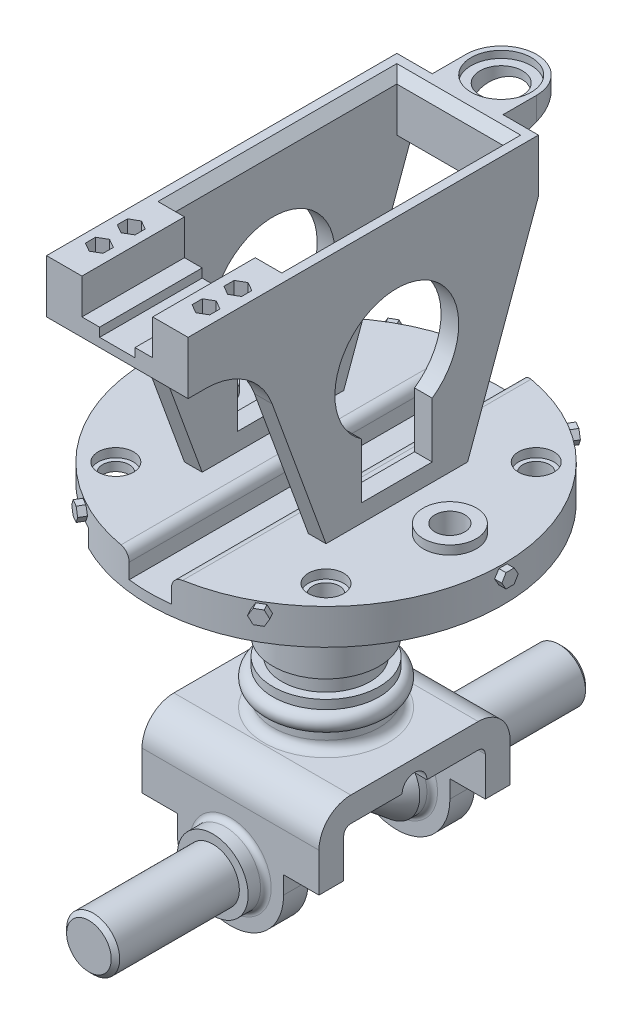
from build123d import *
from build123d.topology import SkipClean

# Parameters (mm, degrees)
SKETCH5_W               = 63.5
SKETCH5_H               = 12.7
SKETCH6_W               = 34.925
SKETCH6_H               = 6.35
CUT_EXTRUDE2_DEPTH      = 63.5
SKETCH7_W               = 15.24
SKETCH7_H               = 8.89
CUT_EXTRUDE3_DEPTH      = 63.5
FILLET1_R               = 3.429
F_3_8_16_TAPPED_HOLE1_D = 9.525
SKETCH14_R              = 6.35
CUT_EXTRUDE4_DEPTH      = 3.175
BOSS_EXTRUDE2_START     = 3.175
SKETCH15_R              = 9.525
SKETCH15_R_2            = 5.35813
BOSS_EXTRUDE2_DEPTH     = 3.175
CHAMFER2_SIZE           = 2.54
BOSS_EXTRUDE3_START     = 63.5
BOSS_EXTRUDE3_DEPTH     = 2.54
CIRPATTERN6_COUNT       = 6
BOSS_EXTRUDE5_DEPTH     = 25.4
SKETCH23_W              = 38.1
SKETCH23_H              = 69.85
CUT_EXTRUDE5_DEPTH      = 81.28
CUT_EXTRUDE6_DEPTH      = 156.868034501
CUT_EXTRUDE7_REACH      = 144.46
SKETCH26_W              = 38.1
SKETCH26_H              = 82.55
CHAMFER1_SIZE           = 3.175
CUT_EXTRUDE8_REACH      = 185.957
CUT_EXTRUDE9_REACH      = 144.46
BOSS_EXTRUDE6_DEPTH     = 12.7
FILLET2_R               = 12.7
CUT_EXTRUDE10_REACH     = 144.807
SKETCH29_R              = 7.62
SKETCH30_R              = 10.795
CUT_EXTRUDE11_DEPTH     = 2.54
BOSS_EXTRUDE7_DEPTH     = 31.75
BOSS_EXTRUDE8_DEPTH     = 8.89
FILLET3_R               = 1.905
FILLET4_R               = 3.175


# Read off the part's stored shape, not the designer's step: 3/4-10 Machine Threads Stud1, 3/4-10 Machine Threads Stud2
with BuildPart() as part:
    # Sketch5 → Revolve1 (revolve)
    with BuildSketch(Plane.XY):
        with Locations((31.75, 6.35)):
            Rectangle(SKETCH5_W, SKETCH5_H)
    revolve(axis=Axis((0, 0, 0), (0, 1, 0)))

    # Sketch6 → Cut-Extrude2 (cut, symmetric)
    with BuildSketch(Plane.XY):
        with Locations((-46.0375, 3.175)):
            Rectangle(SKETCH6_W, SKETCH6_H)
    extrude(amount=CUT_EXTRUDE2_DEPTH, both=True, mode=Mode.SUBTRACT)

    # Sketch7 → Cut-Extrude3 (cut, symmetric)
    with BuildSketch(Plane.XY):
        with Locations((0, 8.255)):
            Rectangle(SKETCH7_W, SKETCH7_H)
    extrude(amount=CUT_EXTRUDE3_DEPTH, both=True, mode=Mode.SUBTRACT)

    # Fillet1
    fillet1_edges = [part.edges().sort_by_distance(p)[0] for p in [
        (-7.62, 12.7, 0),
        (7.62, 12.7, 0),
    ]]
    fillet(fillet1_edges, radius=FILLET1_R)

    # Sketch10 → 1/2-13 Tapped Hole1 (revolve, cut)
    with BuildSketch(Plane(origin=(-44.45, 12.7, 0), x_dir=(0, 0, 1), z_dir=(1, 0, 0))):
        Polygon((0, 0), (0, 34.461489309), (5.35813, 31.242), (5.35813, 0), align=None)
    f_1_2_13_tapped_hole1 = revolve(axis=Axis((-44.45, 19.05, 0), (0, -1, 0)), mode=Mode.SUBTRACT)

    # 3/8-16 Tapped Hole1 (through all)
    with Locations(Plane(origin=(-37.717075708, 12.7, -37.717075708), x_dir=(1, 0, 0), z_dir=(0, 1, 0))):
        with Locations((0, 0), (0, -75.434151416)):
            f_3_8_16_tapped_hole1 = Hole(F_3_8_16_TAPPED_HOLE1_D / 2)

    # Sketch14 → Cut-Extrude4 (cut)
    with BuildSketch(Plane(origin=(0, 12.7, 0), x_dir=(1, 0, 0), z_dir=(0, 1, 0))):
        with Locations(Location((-37.717075708, 37.717075708, 0), (0, 0, 180))):
            Circle(SKETCH14_R)
        with Locations(Location((-37.717075708, -37.717075708, 0), (0, 0, 180))):
            Circle(SKETCH14_R)
    cut_extrude4 = extrude(amount=-CUT_EXTRUDE4_DEPTH, mode=Mode.SUBTRACT)

    # Sketch15 → Boss-Extrude2 (add)
    with SkipClean():  # the faces are left unmerged after this step: merging them gives an invalid solid
        with BuildSketch(Plane(origin=(0, 12.7, 0), x_dir=(1, 0, 0), z_dir=(0, 1, 0)).offset(BOSS_EXTRUDE2_START)):
            with Locations(Location((-44.45, 0, 0), (0, 0, 180))):
                Circle(SKETCH15_R)
            with Locations(Location((-44.45, 0, 0), (0, 0, 180))):
                Circle(SKETCH15_R_2, mode=Mode.SUBTRACT)
        boss_extrude2 = extrude(amount=-BOSS_EXTRUDE2_DEPTH)

    # Mirror1: 1/2-13 Tapped Hole1, 3/8-16 Tapped Hole1, Cut-Extrude4, Boss-Extrude2 across plane
    with SkipClean():  # the faces are left unmerged after this step: merging them gives an invalid solid
        add(f_1_2_13_tapped_hole1.mirror(Plane(origin=(0, 0, 0), x_dir=(0, 0, 1), z_dir=(1, 0, 0))), mode=Mode.SUBTRACT)
        add(f_3_8_16_tapped_hole1.mirror(Plane(origin=(0, 0, 0), x_dir=(0, 0, 1), z_dir=(1, 0, 0))), mode=Mode.SUBTRACT)
        add(cut_extrude4.mirror(Plane(origin=(0, 0, 0), x_dir=(0, 0, 1), z_dir=(1, 0, 0))), mode=Mode.SUBTRACT)
        add(boss_extrude2.mirror(Plane(origin=(0, 0, 0), x_dir=(0, 0, 1), z_dir=(1, 0, 0))))

    # Chamfer2
    chamfer2_edges = [part.edges().sort_by_distance(p)[0] for p in [
        (44.45, 0, -5.35813),
        (-44.45, 6.35, -5.35813),
    ]]
    chamfer(chamfer2_edges, length=CHAMFER2_SIZE)


with BuildPart() as body_2:
    # Sketch17 → Boss-Extrude3 (new, symmetric)
    with BuildSketch(Plane(origin=(0, 0, 0), x_dir=(0, 0, -1), z_dir=(1, 0, 0)).offset(BOSS_EXTRUDE3_START)):
        Polygon((2.932939367, 9.525), (1.466469684, 12.065), (-1.466469684, 12.065), (-2.932939367, 9.525), (-1.466469684, 6.985), (1.466469684, 6.985), align=None)
    boss_extrude3 = extrude(amount=BOSS_EXTRUDE3_DEPTH, both=True)


with BuildPart() as part_1:
    add(part.part)

    # Combine9: union body 2
    add(body_2.part)

    # CirPattern6: Boss-Extrude3 ×6 about axis
    cirpattern6_axis = Axis((0, 0, 0), (0, 1, 0))
    for i in range(1, CIRPATTERN6_COUNT):
        add(boss_extrude3.rotate(cirpattern6_axis, i * 360 / CIRPATTERN6_COUNT))

    # Sketch22 → Boss-Extrude5 (add, symmetric)
    with BuildSketch(Plane(origin=(0, 0, 0), x_dir=(0, 0, -1), z_dir=(1, 0, 0))):
        with BuildLine():
            Line((-25.4, 12.7), (25.4, 12.7))
            Line((25.4, 12.7), (50.823320863, 82.55))
            Line((50.823320863, 82.55), (50.823320863, 101.6))
            Line((50.823320863, 101.6), (-74.906679137, 101.6))
            Line((-74.906679137, 101.6), (-74.906679137, 82.55))
            Line((-74.906679137, 82.55), (-68.608592334, 82.55))
            ThreePointArc((-68.608592334, 82.55), (-54.039750851, 77.956461925), (-44.740399766, 65.83731164))
            Line((-44.740399766, 65.83731164), (-25.4, 12.7))
        make_face()
    extrude(amount=BOSS_EXTRUDE5_DEPTH, both=True)

    # Sketch23 → Cut-Extrude5 (cut, symmetric)
    with BuildSketch(Plane.XY):
        with Locations((0, 47.625)):
            Rectangle(SKETCH23_W, SKETCH23_H)
    extrude(amount=CUT_EXTRUDE5_DEPTH, both=True, mode=Mode.SUBTRACT)

    # Sketch24 → Cut-Extrude6 (cut, through all)
    with BuildSketch(Plane(origin=(25.4, 0, 0), x_dir=(0, 0, -1), z_dir=(1, 0, 0))):
        with BuildLine():
            Line((-12.7, 38.911013597), (-12.7, 19.05))
            Line((-12.7, 19.05), (12.7, 19.05))
            Line((12.7, 19.05), (12.7, 38.911013597))
            ThreePointArc((12.7, 38.911013597), (0, 79.375), (-12.7, 38.911013597))
        make_face()
    extrude(amount=-CUT_EXTRUDE6_DEPTH, mode=Mode.SUBTRACT)

    # Sketch26 → Cut-Extrude7 (cut, up to next)
    with BuildSketch(Plane(origin=(0, 101.6, 0), x_dir=(1, 0, 0), z_dir=(0, 1, 0)), mode=Mode.PRIVATE) as cut_extrude7_sk1:
        with Locations((0, 3.175)):
            Rectangle(SKETCH26_W, SKETCH26_H)
    cut_extrude7_tool1 = extrude(cut_extrude7_sk1.sketch, amount=-CUT_EXTRUDE7_REACH, mode=Mode.PRIVATE) & part_1.part
    add(cut_extrude7_tool1.solids().sort_by_distance((0, 101.6, -3.175))[0], mode=Mode.SUBTRACT)

    # Chamfer1
    chamfer1_edges = [part_1.edges().sort_by_distance(p)[0] for p in [
        (19.05, 101.6, -3.175),
        (0, 101.6, -44.45),
        (-19.05, 101.6, -3.175),
    ]]
    chamfer(chamfer1_edges, length=CHAMFER1_SIZE)

    # Sketch25 → Cut-Extrude8 (cut, up to next)
    with BuildSketch(Plane.XY.offset(74.906679137), mode=Mode.PRIVATE) as cut_extrude8_sk1:
        Polygon((-12.7, 101.6), (-12.7, 88.9), (-6.35, 88.9), (-6.35, 85.725), (6.35, 85.725), (6.35, 88.9), (12.7, 88.9), (12.7, 101.6), align=None)
    cut_extrude8_tool1 = extrude(cut_extrude8_sk1.sketch, amount=-CUT_EXTRUDE8_REACH, mode=Mode.PRIVATE) & part_1.part
    add(cut_extrude8_tool1.solids().sort_by_distance((0, 94.368056, 74.906679))[0], mode=Mode.SUBTRACT)

    # Sketch27 → Cut-Extrude9 (cut, up to next)
    with BuildSketch(Plane(origin=(0, 101.6, 0), x_dir=(1, 0, 0), z_dir=(0, 1, 0)), mode=Mode.PRIVATE) as cut_extrude9_sk1:
        Polygon((-19.135398798, -65.872853346), (-15.960398798, -64.039766241), (-15.960398798, -60.373592032), (-19.135398798, -58.540504927), (-22.310398798, -60.373592032), (-22.310398798, -64.039766241), align=None)
    cut_extrude9_tool1 = extrude(cut_extrude9_sk1.sketch, amount=-CUT_EXTRUDE9_REACH, mode=Mode.PRIVATE) & part_1.part
    # Sketch27 → Cut-Extrude9 (cut, up to next)
    with BuildSketch(Plane(origin=(0, 101.6, 0), x_dir=(1, 0, 0), z_dir=(0, 1, 0)), mode=Mode.PRIVATE) as cut_extrude9_sk2:
        Polygon((-19.135398798, -54.442853346), (-15.960398798, -52.609766241), (-15.960398798, -48.943592032), (-19.135398798, -47.110504927), (-22.310398798, -48.943592032), (-22.310398798, -52.609766241), align=None)
    cut_extrude9_tool2 = extrude(cut_extrude9_sk2.sketch, amount=-CUT_EXTRUDE9_REACH, mode=Mode.PRIVATE) & part_1.part
    # Sketch27 → Cut-Extrude9 (cut, up to next)
    with BuildSketch(Plane(origin=(0, 101.6, 0), x_dir=(1, 0, 0), z_dir=(0, 1, 0)), mode=Mode.PRIVATE) as cut_extrude9_sk3:
        Polygon((22.310398798, -64.039766241), (19.135398798, -65.872853346), (15.960398798, -64.039766241), (15.960398798, -60.373592032), (19.135398798, -58.540504927), (22.310398798, -60.373592032), align=None)
    cut_extrude9_tool3 = extrude(cut_extrude9_sk3.sketch, amount=-CUT_EXTRUDE9_REACH, mode=Mode.PRIVATE) & part_1.part
    # Sketch27 → Cut-Extrude9 (cut, up to next)
    with BuildSketch(Plane(origin=(0, 101.6, 0), x_dir=(1, 0, 0), z_dir=(0, 1, 0)), mode=Mode.PRIVATE) as cut_extrude9_sk4:
        Polygon((22.310398798, -52.609766241), (19.135398798, -54.442853346), (15.960398798, -52.609766241), (15.960398798, -48.943592032), (19.135398798, -47.110504927), (22.310398798, -48.943592032), align=None)
    cut_extrude9_tool4 = extrude(cut_extrude9_sk4.sketch, amount=-CUT_EXTRUDE9_REACH, mode=Mode.PRIVATE) & part_1.part
    add(cut_extrude9_tool1.solids().sort_by_distance((-19.135399, 101.6, 62.206679))[0], mode=Mode.SUBTRACT)
    add(cut_extrude9_tool2.solids().sort_by_distance((-19.135399, 101.6, 50.776679))[0], mode=Mode.SUBTRACT)
    add(cut_extrude9_tool3.solids().sort_by_distance((19.135399, 101.6, 62.206679))[0], mode=Mode.SUBTRACT)
    add(cut_extrude9_tool4.solids().sort_by_distance((19.135399, 101.6, 50.776679))[0], mode=Mode.SUBTRACT)

    # Sketch28 → Boss-Extrude6 (add, symmetric)
    with BuildSketch(Plane(origin=(0, 0, 0), x_dir=(0, 0, -1), z_dir=(1, 0, 0))):
        Polygon((50.823320863, 101.6), (75.565, 101.6), (75.565, 98.171), (50.823320863, 88.9), align=None)
    extrude(amount=BOSS_EXTRUDE6_DEPTH, both=True)

    # Fillet2
    fillet2_edges = [part_1.edges().sort_by_distance(p)[0] for p in [
        (-12.7, 99.8855, -75.565),
        (12.7, 99.8855, -75.565),
    ]]
    fillet(fillet2_edges, radius=FILLET2_R - 0.0001)  # a hair under: the kernel refuses the full size

    # Cut-Extrude10: up to this plane
    cut_extrude10_end = Plane(origin=(12.7, 98.171, -75.565), z_dir=(0, 0.9364178630194615, 0.35088685614890874))
    # Sketch29 → Cut-Extrude10 (cut, up to the surface)
    with BuildSketch(Plane(origin=(0, 101.6, 0), x_dir=(1, 0, 0), z_dir=(0, 1, 0)), mode=Mode.PRIVATE) as cut_extrude10_sk1:
        with Locations(Location((0, 62.865, 0), (0, 0, 270))):
            Circle(SKETCH29_R)
    cut_extrude10_tool1 = split(extrude(cut_extrude10_sk1.sketch, amount=-CUT_EXTRUDE10_REACH, mode=Mode.PRIVATE), bisect_by=cut_extrude10_end, keep=Keep.BOTH, mode=Mode.PRIVATE)
    add(cut_extrude10_tool1.solids().sort_by_distance((0, 101.6, -62.865))[0], mode=Mode.SUBTRACT)

    # Sketch30 → Cut-Extrude11 (cut)
    with BuildSketch(Plane(origin=(0, 101.6, 0), x_dir=(1, 0, 0), z_dir=(0, 1, 0))):
        with Locations(Location((0, 62.865, 0), (0, 0, 270))):
            Circle(SKETCH30_R)
    extrude(amount=-CUT_EXTRUDE11_DEPTH, mode=Mode.SUBTRACT)

    # Sketch32 → Revolve2 (revolve)
    with BuildSketch(Plane(origin=(0, 0, 0), x_dir=(0, 0, -1), z_dir=(1, 0, 0))):
        with BuildLine():
            Line((0, 0), (19.05, 0))
            Line((19.05, 0), (19.05, -41.275))
            Line((19.05, -41.275), (15.875, -41.275))
            Line((15.875, -41.275), (15.875, -47.625))
            Line((15.875, -47.625), (19.05, -47.625))
            Line((19.05, -47.625), (19.05, -50.8))
            ThreePointArc((19.05, -50.8), (22.225, -53.975), (19.05, -57.15))
            Line((19.05, -57.15), (19.05, -63.5))
            Line((19.05, -63.5), (0, -63.5))
            Line((0, -63.5), (0, 0))
        make_face()
    revolve(axis=Axis((0, -63.5, 0), (0, 1, 0)))

    # Sketch33 → Boss-Extrude7 (add, symmetric)
    with BuildSketch(Plane(origin=(0, 0, 0), x_dir=(0, 0, -1), z_dir=(1, 0, 0))):
        with BuildLine():
            Line((0, -63.5), (22.86, -63.5))
            ThreePointArc((22.86, -63.5), (30.942230509, -66.847769491), (34.29, -74.93))
            Line((34.29, -74.93), (34.29, -88.9))
            Line((34.29, -88.9), (25.4, -88.9))
            Line((25.4, -88.9), (25.4, -74.93))
            ThreePointArc((25.4, -74.93), (24.656051224, -73.133948776), (22.86, -72.39))
            Line((22.86, -72.39), (4.445, -72.39))
            ThreePointArc((4.445, -72.39), (0, -67.945), (-4.445, -72.39))
            Line((-4.445, -72.39), (-22.86, -72.39))
            ThreePointArc((-22.86, -72.39), (-24.656051224, -73.133948776), (-25.4, -74.93))
            Line((-25.4, -74.93), (-25.4, -88.9))
            Line((-25.4, -88.9), (-34.29, -88.9))
            Line((-34.29, -88.9), (-34.29, -74.93))
            ThreePointArc((-34.29, -74.93), (-30.942230509, -66.847769491), (-22.86, -63.5))
            Line((-22.86, -63.5), (0, -63.5))
        make_face()
    extrude(amount=BOSS_EXTRUDE7_DEPTH, both=True)

    # Sketch34 → Boss-Extrude8 (add)
    with BuildSketch(Plane(origin=(0, 0, -34.29), x_dir=(-1, 0, 0), z_dir=(0, 0, -1))):
        with BuildLine():
            Line((-19.05, -95.25), (-19.05, -88.9))
            Line((-19.05, -88.9), (19.05, -88.9))
            Line((19.05, -88.9), (19.05, -95.25))
            ThreePointArc((19.05, -95.25), (0, -114.3), (-19.05, -95.25))
        make_face()
    boss_extrude8 = extrude(amount=-BOSS_EXTRUDE8_DEPTH)

    # Mirror2: Boss-Extrude8 across plane
    add(boss_extrude8.mirror(Plane.XY))

    # Sketch36 → Revolve3 (revolve)
    with BuildSketch(Plane(origin=(0, 0, 0), x_dir=(0, 0, -1), z_dir=(1, 0, 0)), mode=Mode.PRIVATE) as revolve3_sk:
        Polygon((-25.4, -82.55), (-20.955, -82.55), (-11.43, -90.17), (11.43, -90.17), (20.955, -82.55), (25.4, -82.55), (25.4, -95.25), (-25.4, -95.25), align=None)
        Polygon((34.29, -95.25), (85.09, -95.25), (85.09, -85.725), (40.64, -85.725), (40.64, -82.55), (34.29, -82.55), align=None)
        Polygon((-40.64, -82.55), (-34.29, -82.55), (-34.29, -95.25), (-85.09, -95.25), (-85.09, -85.725), (-40.64, -85.725), align=None)
    revolve(revolve3_sk.sketch.rotate(Axis((0, -95.25, 34.29), (0, 0, 1)), 90), axis=Axis((0, -95.25, 34.29), (0, 0, 1)))

    # Fillet3
    fillet3_edges = [part_1.edges().sort_by_distance(p)[0] for p in [
        (12.7, -95.25, 34.29),
        (12.7, -95.25, -34.29),
        (12.7, -95.25, 25.4),
        (12.7, -95.25, -25.4),
    ]]
    fillet(fillet3_edges, radius=FILLET3_R)

    # 3/4-10 Machine Threads Stud1 outline → 3/4-10 Machine Threads Stud1 (revolve, cut)
    with BuildSketch(Plane.XZ.offset(95.25)):
        Polygon((9.525, -83.57743), (8.01243, -85.09), (9.525, -85.09), align=None)
    revolve(axis=Axis((0, -95.25, 0), (0, 0, 1)), mode=Mode.SUBTRACT)

    # 3/4-10 Machine Threads Stud2 outline → 3/4-10 Machine Threads Stud2 (revolve, cut)
    with BuildSketch(Plane.XZ.offset(95.25)):
        Polygon((9.525, 85.09), (8.01243, 85.09), (9.525, 83.57743), align=None)
    revolve(axis=Axis((0, -95.25, 0), (0, 0, 1)), mode=Mode.SUBTRACT)

    # Fillet4
    fillet4_edges = [part_1.edges().sort_by_distance(p)[0] for p in [
        (0, 0, 19.05),
        (0, -63.5, 19.05),
    ]]
    fillet(fillet4_edges, radius=FILLET4_R)


solid = part_1.part
